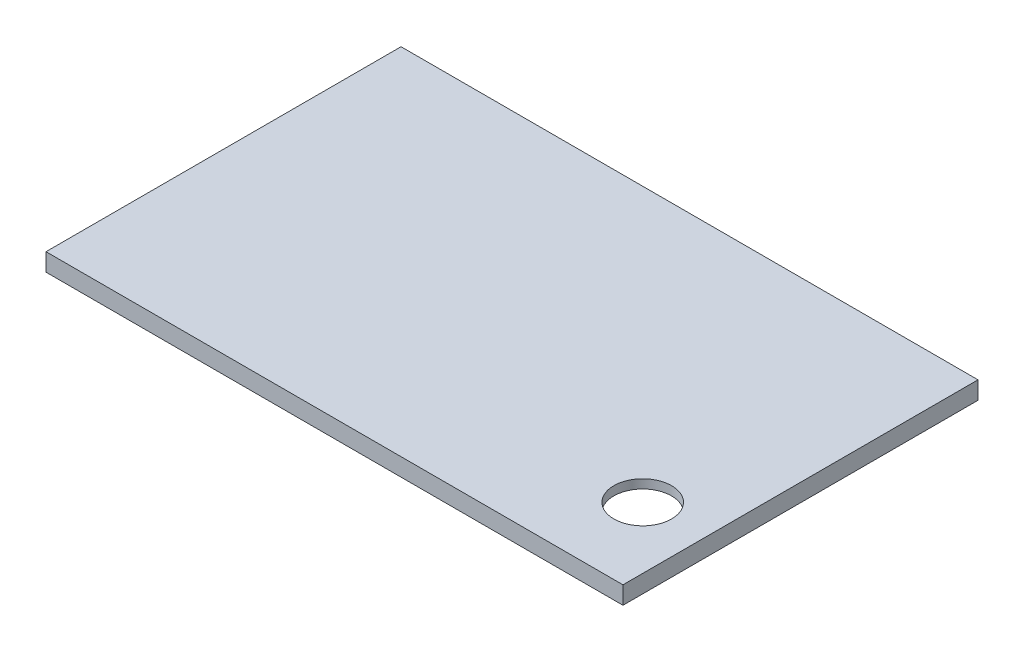
from build123d import *

# Parameters (mm, degrees)
SKETCH1_W           = 65
SKETCH1_H           = 40
BOSS_EXTRUDE1_DEPTH = 45
SHELL1_T            = -1
SKETCH2_R           = 5
CUT_EXTRUDE1_DEPTH  = 8
SKETCH3_R           = 7.5
CUT_EXTRUDE2_DEPTH  = 8
FILLET1_R           = 2
FILLET2_R           = 2.5
SKETCH5_W           = 66.843722153
SKETCH5_H           = 46.578661822
CUT_EXTRUDE3_DEPTH  = 250
SKETCH7_W           = 65
SKETCH7_H           = 40
BOSS_EXTRUDE3_DEPTH = 1
SKETCH8_R           = 3.25
CUT_EXTRUDE4_DEPTH  = 7


with BuildPart() as part:
    # Sketch1 → Boss-Extrude1 (new body)
    with BuildSketch(Plane(origin=(0, 0, 0), x_dir=(1, 0, 0), z_dir=(0, 1, 0))):
        Rectangle(SKETCH1_W, SKETCH1_H)
    extrude(amount=BOSS_EXTRUDE1_DEPTH)

    # Shell1
    shell1_openings = [part.faces().sort_by_distance(p)[0] for p in [
        (0, 45, 0),
    ]]
    offset(amount=SHELL1_T, openings=shell1_openings, kind=Kind.INTERSECTION)

    # Sketch2 → Cut-Extrude1 (cut)
    with BuildSketch(Plane(origin=(32.5, 0, 0), x_dir=(0, 0, -1), z_dir=(1, 0, 0))):
        with Locations((0, 26)):
            Circle(SKETCH2_R)
    extrude(amount=-CUT_EXTRUDE1_DEPTH, mode=Mode.SUBTRACT)

    # Sketch3 → Cut-Extrude2 (cut)
    with BuildSketch(Plane.XZ):
        with Locations(Location((0, 0, 0), (0, 0, 270))):
            Circle(SKETCH3_R)
    extrude(amount=-CUT_EXTRUDE2_DEPTH, mode=Mode.SUBTRACT)

    # Fillet1
    # the kernel refuses this fillet: 2 mm, written as the material it adds along each edge
    with BuildSketch(Plane(origin=(31.5, 1, 19), x_dir=(0, 1, 0), z_dir=(0, 0, -1)), Plane(origin=(-31.5, 1, -19), x_dir=(0, 1, 0), z_dir=(0, 0, 1))) as fillet1_piece_1:
        with BuildLine():
            CenterArc((FILLET1_R, -FILLET1_R), FILLET1_R, 90, 90)
            Line((0, -FILLET1_R), (0, 0))
            Line((0, 0), (FILLET1_R, 0))
        make_face()
    extrude(amount=38)
    with BuildSketch(Plane(origin=(31.5, 1, -19), x_dir=(0, 1, 0), z_dir=(-1, 0, 0)), Plane(origin=(-31.5, 1, 19), x_dir=(0, 1, 0), z_dir=(1, 0, 0))) as fillet1_piece_2:
        with BuildLine():
            CenterArc((FILLET1_R, -FILLET1_R), FILLET1_R, 90, 90)
            Line((0, -FILLET1_R), (0, 0))
            Line((0, 0), (FILLET1_R, 0))
        make_face()
    extrude(amount=63)
    # the kernel refuses this fillet: 2 mm, written as the material it takes off along each edge
    with BuildSketch(Plane(origin=(0, 1, 0), x_dir=(0, 0, -1), z_dir=(-1, 0, 0))) as fillet1_2_piece_1:
        with BuildLine():
            CenterArc((9.232050808, 2), FILLET1_R, 210, 60)
            Line((9.232050808, 0), (7.5, 0))
            Line((7.5, 0), (7.5, 1))
        make_face()
    revolve(axis=Axis((0, 1, 0), (0, -1, 0)), mode=Mode.SUBTRACT)

    # Fillet2
    # the kernel refuses this fillet: 2.5 mm, written as the material it adds along each edge
    with BuildSketch(Plane(origin=(-29, 1, -16.5), x_dir=(-1, 0, 0), z_dir=(0, 0, 1))) as fillet2_piece_1:
        with BuildLine():
            CenterArc((0.5, -2), 2, 0, 90)
            Line((2.5, -2), (2.5, 0))
            Line((2.5, 0), (0.5, 0))
        make_face()
    revolve(axis=Axis((-29, 1, -16.5), (0, -1, 0)), revolution_arc=90)
    with BuildSketch(Plane(origin=(29, 1, -16.5), x_dir=(0, 0, -1), z_dir=(-1, 0, 0))) as fillet2_piece_2:
        with BuildLine():
            CenterArc((0.5, -2), 2, 0, 90)
            Line((2.5, -2), (2.5, 0))
            Line((2.5, 0), (0.5, 0))
        make_face()
    revolve(axis=Axis((29, 1, -16.5), (0, -1, 0)), revolution_arc=90)
    with BuildSketch(Plane(origin=(-29, 1, 16.5), x_dir=(0, 0, 1), z_dir=(1, 0, 0))) as fillet2_piece_3:
        with BuildLine():
            CenterArc((0.5, -2), 2, 0, 90)
            Line((2.5, -2), (2.5, 0))
            Line((2.5, 0), (0.5, 0))
        make_face()
    revolve(axis=Axis((-29, 1, 16.5), (0, -1, 0)), revolution_arc=90)
    with BuildSketch(Plane(origin=(29, 1, 16.5), x_dir=(1, 0, 0), z_dir=(0, 0, -1))) as fillet2_piece_4:
        with BuildLine():
            CenterArc((0.5, -2), 2, 0, 90)
            Line((2.5, -2), (2.5, 0))
            Line((2.5, 0), (0.5, 0))
        make_face()
    revolve(axis=Axis((29, 1, 16.5), (0, -1, 0)), revolution_arc=90)
    with BuildSketch(Plane(origin=(31.5, 1, 19), x_dir=(0, 0, -1), z_dir=(0, 1, 0)), Plane(origin=(31.5, 1, -19), x_dir=(-1, 0, 0), z_dir=(0, 1, 0)), Plane(origin=(-31.5, 45, 19), x_dir=(0, 0, -1), z_dir=(0, -1, 0))) as fillet2_piece_5:
        with BuildLine():
            CenterArc((FILLET2_R, FILLET2_R), FILLET2_R, 180, 90)
            Line((0, FILLET2_R), (0, 0))
            Line((0, 0), (FILLET2_R, 0))
        make_face()
    extrude(amount=44)
    with BuildSketch(Plane(origin=(-31.5, 1, -19), x_dir=(1, 0, 0), z_dir=(0, 1, 0))) as fillet2_piece_6:
        with BuildLine():
            CenterArc((FILLET2_R, -FILLET2_R), FILLET2_R, 90, 90)
            Line((0, -FILLET2_R), (0, 0))
            Line((0, 0), (FILLET2_R, 0))
        make_face()
    extrude(amount=44)

    # Sketch5 → Cut-Extrude3 (cut)
    with BuildSketch(Plane.XY.offset(20)):
        with Locations((0.921861077, 20.710669089)):
            Rectangle(SKETCH5_W, SKETCH5_H)
    extrude(amount=-CUT_EXTRUDE3_DEPTH, mode=Mode.SUBTRACT)

    # Sketch7 → Boss-Extrude3 (add)
    with BuildSketch(Plane(origin=(0, 45, 0), x_dir=(1, 0, 0), z_dir=(0, 1, 0))):
        Rectangle(SKETCH7_W, SKETCH7_H)
    extrude(amount=BOSS_EXTRUDE3_DEPTH)

    # Sketch8 → Cut-Extrude4 (cut)
    with BuildSketch(Plane(origin=(0, 46, 0), x_dir=(1, 0, 0), z_dir=(0, 1, 0))):
        with Locations(Location((25.564279631, -10.838515608, 0), (0, 0, 270))):
            Circle(SKETCH8_R)
    extrude(amount=-CUT_EXTRUDE4_DEPTH, mode=Mode.SUBTRACT)


solid = part.part
